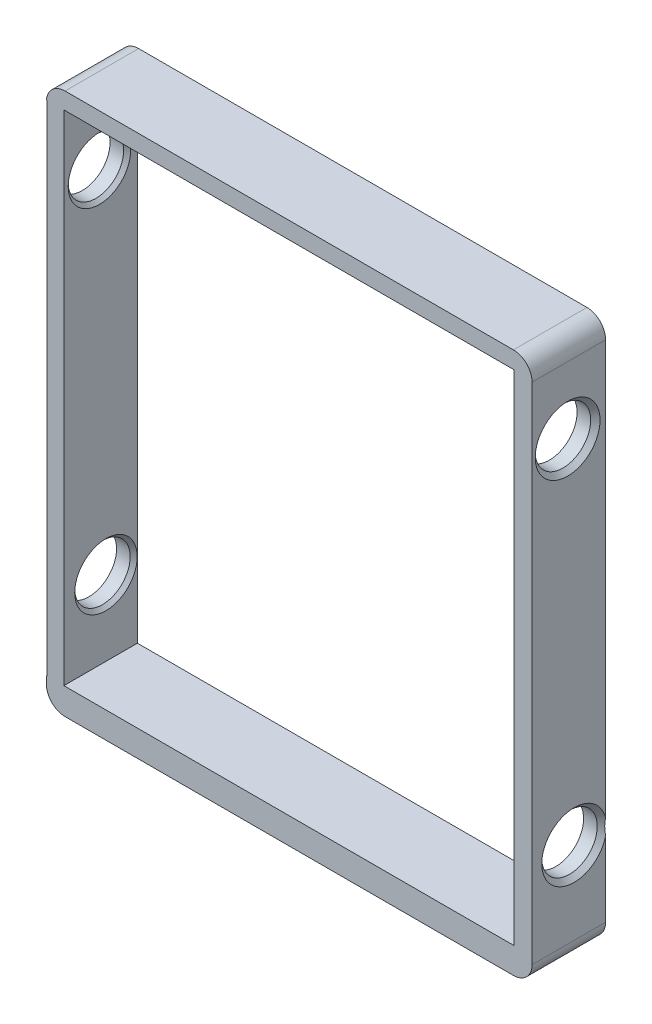
from build123d import *

# Parameters (mm, degrees)
SKETCH1_W                                  = 66.04
SKETCH1_H                                  = 73.66
BOSS_EXTRUDE1_DEPTH                        = 66.04
CONVERT_SOLID1_START                       = 10
CONVERT_SOLID1_OUTLINE_W                   = 66.04
CONVERT_SOLID1_OUTLINE_H                   = 73.66
CONVERT_SOLID1_DEPTH                       = 56.04
SKETCH12_W                                 = 61.174671733
SKETCH12_H                                 = 67.796672281
CUT_EXTRUDE1_DEPTH                         = 71.66800329
FILLET1_R                                  = 2.54
CBORE_FOR_8_FILLISTER_HEAD_MACHINE_2_COUNT = 2
CBORE_FOR_8_FILLISTER_HEAD_MACHINE_2_PITCH = 48.289098212
LPATTERN1_COUNT                            = 2
LPATTERN1_PITCH                            = 63.5


# Read off the part's stored shape, not the designer's step: Convert-Solid1
with BuildPart() as part:
    # Sketch1 → Boss-Extrude1 (new body)
    with BuildSketch(Plane.XY):
        with Locations((-6.510518448, 20.887456633)):
            Rectangle(SKETCH1_W, SKETCH1_H)
    extrude(amount=BOSS_EXTRUDE1_DEPTH)

    # Convert-Solid1 outline → Convert-Solid1 (cut)
    with BuildSketch(Plane.XY.offset(CONVERT_SOLID1_START)):
        with Locations((-6.510518448, 20.887456633)):
            Rectangle(CONVERT_SOLID1_OUTLINE_W, CONVERT_SOLID1_OUTLINE_H)
    extrude(amount=CONVERT_SOLID1_DEPTH, mode=Mode.SUBTRACT)

    # Sketch12 → Cut-Extrude1 (cut, symmetric)
    with BuildSketch(Plane(origin=(0, 0, 0), x_dir=(-1, 0, 0), z_dir=(0, 0, -1))):
        with Locations((6.563074008, 21.518123352)):
            Rectangle(SKETCH12_W, SKETCH12_H)
    cut_extrude1 = extrude(amount=CUT_EXTRUDE1_DEPTH, both=True, mode=Mode.SUBTRACT)

    # Fillet1
    fillet1_edges = [part.edges().sort_by_distance(p)[0] for p in [
        (-39.530518448, 57.717456633, 5),
        (-39.530518448, -15.942543367, 5),
        (26.509481552, -15.942543367, 5),
        (26.509481552, 57.717456633, 5),
    ]]
    fillet(fillet1_edges, radius=FILLET1_R)

    # Sketch18 → CBORE for #8 Fillister Head Machine Screw1 (revolve, cut)
    with BuildSketch(Plane(origin=(26.509481552, 46.108209089, 5.16610426), x_dir=(0, 0, -1), z_dir=(0, 1, 0))):
        Polygon((0, 0), (0, 26.750674586), (2.2479, 25.4), (2.2479, 3.9624), (3.77063, 3.9624), (3.77063, 0.635), (4.40563, 0), align=None)
    cbore_for_8_fillister_head_machine_scre = revolve(axis=Axis((32.859481552, 46.108209089, 5.16610426), (-1, 0, 0)), mode=Mode.SUBTRACT)

    # CBORE for _8 Fillister Head Machine  2: CBORE for #8 Fillister Head Machine Screw1 ×2
    with Locations(*[Vector(0, -0.9998317064949376, -0.018345535898989723) * (i * CBORE_FOR_8_FILLISTER_HEAD_MACHINE_2_PITCH) for i in range(1, CBORE_FOR_8_FILLISTER_HEAD_MACHINE_2_COUNT)]):
        add(cbore_for_8_fillister_head_machine_scre, mode=Mode.SUBTRACT)

    # LPattern1: Cut-Extrude1, CBORE for #8 Fillister Head Machine Screw1 ×2
    with Locations(*[(-i * LPATTERN1_PITCH, 0, 0) for i in range(1, LPATTERN1_COUNT)]):
        add(cut_extrude1, mode=Mode.SUBTRACT)
        add(cbore_for_8_fillister_head_machine_scre, mode=Mode.SUBTRACT)

    # LPattern1 copy 1 sketch → LPattern1 copy 1 (revolve, cut)
    with BuildSketch(Plane(origin=(-36.990518448, -2.172762381, 4.280214875), x_dir=(0, 0, -1), z_dir=(0, 1, 0))):
        Polygon((0, 0), (0, 26.750674586), (2.2479, 25.4), (2.2479, 3.9624), (3.77063, 3.9624), (3.77063, 0.635), (4.40563, 0), align=None)
    revolve(axis=Axis((-30.640518448, -2.172762381, 4.280214875), (-1, 0, 0)), mode=Mode.SUBTRACT)


solid = part.part
